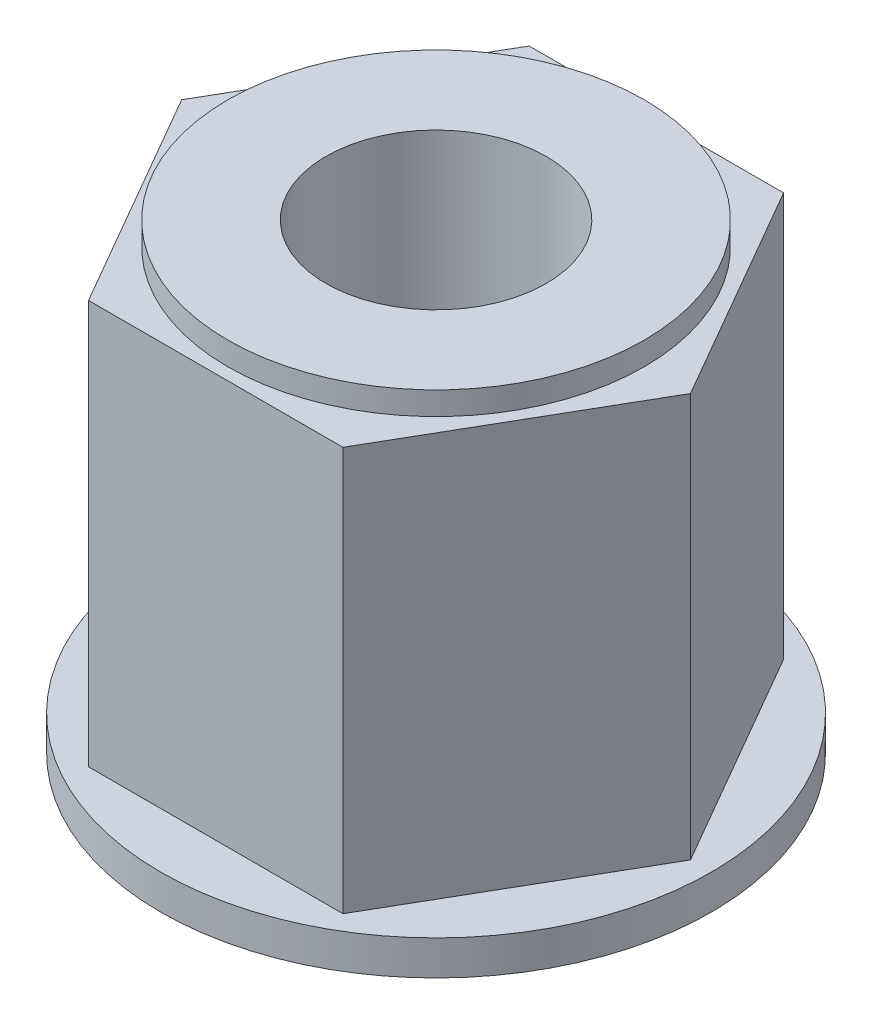
from build123d import *

# Parameters (mm, degrees)
SKETCH1_W            = 11.90625
SKETCH1_H            = 1.5
BOSS_EXTRUDE1_DEPTH  = 17.4625
SKETCH3_W            = 9
SKETCH3_H            = 1
M8_CLEARANCE_HOLE1_D = 9.525


with BuildPart() as part:
    # Sketch1 → Revolve1 (revolve)
    with BuildSketch(Plane(origin=(0, 0, 0), x_dir=(-1, 0, 0), z_dir=(0, 0, -1))):
        with Locations((-5.953125, -0.75)):
            Rectangle(SKETCH1_W, SKETCH1_H)
    revolve(axis=Axis((0, -1.5, 0), (0, 1, 0)))

    # Sketch2 → Boss-Extrude1 (add)
    with BuildSketch(Plane(origin=(0, 0, 0), x_dir=(-1, 0, 0), z_dir=(0, 1, 0))):
        Polygon((10.998522628, 0), (5.499261314, -9.525), (-5.499261314, -9.525), (-10.998522628, 0), (-5.499261314, 9.525), (5.499261314, 9.525), align=None)
    extrude(amount=BOSS_EXTRUDE1_DEPTH)

    # Sketch3 → Revolve2 (revolve)
    with BuildSketch(Plane.XY):
        with Locations((4.5, 17.9625)):
            Rectangle(SKETCH3_W, SKETCH3_H)
    revolve(axis=Axis((0, 18.4625, 0), (0, -1, 0)))

    # M8 Clearance Hole1 (through all)
    with Locations(Plane(origin=(0, -1.5, 0), x_dir=(-1, 0, 0), z_dir=(0, -1, 0))):
        with Locations((0, 0)):
            Hole(M8_CLEARANCE_HOLE1_D / 2)


solid = part.part
